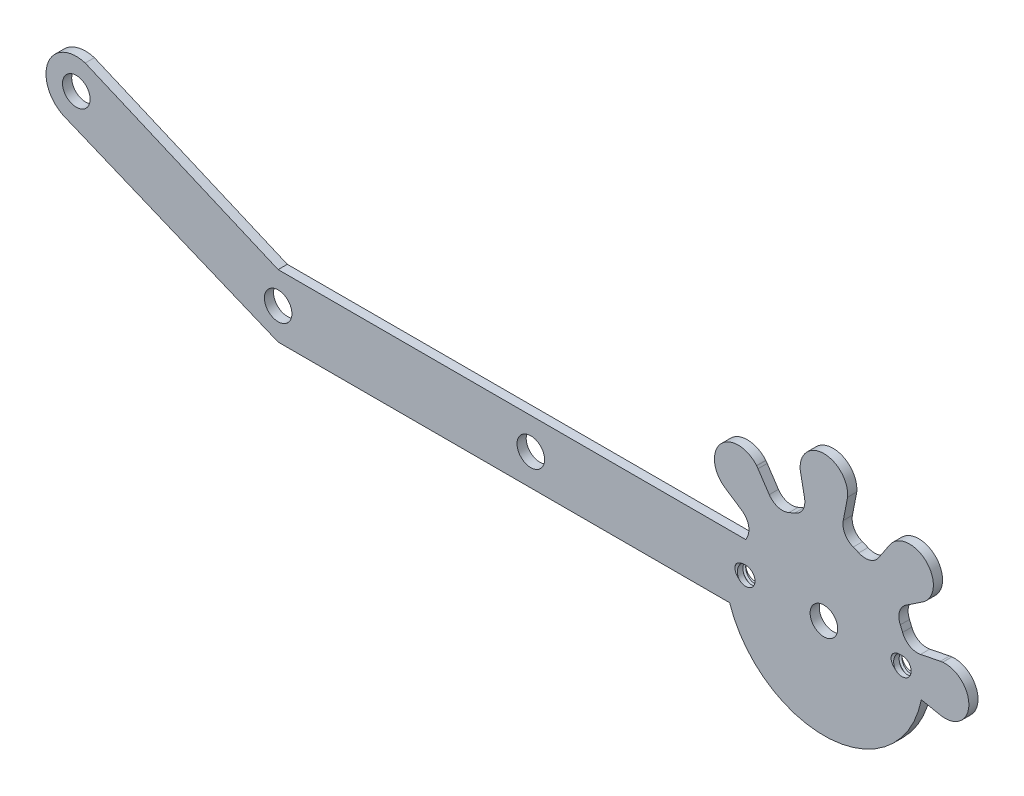
from build123d import *

# Parameters (mm, degrees)
MODEL_R                 = 1.5
MODEL_R_2               = 1
SALIENTE_EXTRUIR1_DEPTH = 1
ROSCA1_PITCH            = 0.9
ROSCA2_PITCH            = 0.9


with BuildPart() as part:
    # Model → Saliente-Extruir1 (new body)
    with BuildSketch(Plane.XY):
        with BuildLine():
            Line((64.920529254, 22.665964647), (65.392141921, 25.094713774))
            ThreePointArc((65.392141921, 25.094713774), (62.813729413, 27.921774704), (60.235316905, 25.094713774))
            Line((60.235316905, 25.094713774), (60.706929569, 22.665964648))
            ThreePointArc((60.706929569, 22.665964648), (60.522536002, 21.487316644), (59.617797329, 20.709717749))
            Line((59.617797329, 20.709717749), (59.017410103, 20.461029219))
            ThreePointArc((59.017410103, 20.461029219), (57.827817801, 20.37112782), (56.864001863, 21.074171875))
            Line((56.864001863, 21.074171875), (55.643604115, 22.905712275))
            ThreePointArc((55.643604115, 22.905712275), (55.574607075, 23.004223882), (55.501109991, 23.099425284))
            Line((55.501109991, 23.099425284), (55.4800974, 23.125037364))
            ThreePointArc((55.4800974, 23.125037364), (51.657850476, 23.30085835), (51.833671462, 19.478611426))
            Line((51.833671462, 19.478611426), (51.859283542, 19.457598835))
            ThreePointArc((51.859283542, 19.457598835), (51.954484944, 19.384101751), (52.052996551, 19.315104711))
            Line((52.052996551, 19.315104711), (53.884536951, 18.094706963))
            ThreePointArc((53.884536951, 18.094706963), (54.587581006, 17.130891025), (54.497679607, 15.941298723))
            ThreePointArc((54.497679607, 15.941298723), (54.413761816, 15.751815845), (54.334160767, 15.560479415))
            Line((54.334160767, 15.560479415), (30.913729409, 15.560479415))
            Line((30.913729409, 15.560479415), (3.413729409, 15.560479415))
            Line((3.413729409, 15.560479415), (-17.587002389, 24.534844015))
            ThreePointArc((-17.587002389, 24.534844015), (-21.676047123, 22.446375255), (-19.719697987, 18.292499154))
            Line((-19.719697987, 18.292499154), (3.413729409, 8.729479415))
            Line((3.413729409, 8.729479415), (30.913729409, 8.729479415))
            Line((30.913729409, 8.729479415), (52.551429091, 8.729479415))
            ThreePointArc((52.551429091, 8.729479415), (63.482015125, 1.349895241), (73.418940011, 10.021313662))
            Line((73.418940011, 10.021313662), (75.492760807, 9.606036458))
            ThreePointArc((75.492760807, 9.606036458), (75.611207308, 9.585166507), (75.730495152, 9.569819236))
            Line((75.730495152, 9.569819236), (75.763463773, 9.566566906))
            ThreePointArc((75.763463773, 9.566566906), (78.590524703, 12.144979414), (75.763463773, 14.723391922))
            Line((75.763463773, 14.723391922), (75.730495152, 14.720139592))
            ThreePointArc((75.730495152, 14.720139592), (75.61120731, 14.704792322), (75.49276081, 14.683922371))
            Line((75.49276081, 14.683922371), (73.334714643, 14.251779259))
            ThreePointArc((73.334714643, 14.251779259), (72.156066639, 14.436172826), (71.378467745, 15.340911498))
            ThreePointArc((71.378467745, 15.340911498), (71.259460181, 15.643315645), (71.129779214, 15.941298723))
            ThreePointArc((71.129779214, 15.941298723), (71.039877814, 17.130891025), (71.74292187, 18.094706964))
            Line((71.74292187, 18.094706964), (73.57446227, 19.315104712))
            ThreePointArc((73.57446227, 19.315104712), (73.672973877, 19.384101752), (73.768175279, 19.457598836))
            Line((73.768175279, 19.457598836), (73.793787359, 19.478611427))
            ThreePointArc((73.793787359, 19.478611427), (73.969608345, 23.300858351), (70.147361421, 23.125037365))
            Line((70.147361421, 23.125037365), (70.12634883, 23.099425285))
            ThreePointArc((70.12634883, 23.099425285), (70.052851746, 23.004223883), (69.983854706, 22.905712276))
            Line((69.983854706, 22.905712276), (68.763456957, 21.074171875))
            ThreePointArc((68.763456957, 21.074171875), (67.799641018, 20.371127819), (66.610048715, 20.461029218))
            ThreePointArc((66.610048715, 20.461029218), (66.312065639, 20.590710184), (66.009661494, 20.709717748))
            ThreePointArc((66.009661494, 20.709717748), (65.104922821, 21.487316642), (64.920529254, 22.665964647))
        make_face()
        with Locations((62.813729411, 12.144979414)):
            Circle(MODEL_R, mode=Mode.SUBTRACT)
        with Locations((30.913729409, 12.144979414)):
            Circle(MODEL_R, mode=Mode.SUBTRACT)
        with Locations((3.413729409, 12.144979414)):
            Circle(MODEL_R, mode=Mode.SUBTRACT)
        with Locations((-18.553270591, 21.379479415)):
            Circle(MODEL_R, mode=Mode.SUBTRACT)
        with Locations((54.313749997, 12.144979414)):
            Circle(MODEL_R_2, mode=Mode.SUBTRACT)
        with Locations((71.313708825, 12.144979414)):
            Circle(MODEL_R_2, mode=Mode.SUBTRACT)
    extrude(amount=SALIENTE_EXTRUIR1_DEPTH)

    # Rosca1: the profile of Perfil de rosca1 profile screwed along a right-hand helix of 11.111111 turns, 8 arcs to a turn; built about Z, then put on its axis
    rosca1_z = Axis((0, 0, 0), (0, 0, 1))
    rosca1_corners = [(0.9997, 0, -0.000173205), (1.21650635, 0, 0.124999999), (1.21650635, 0, 0.174999999), (0.9997, 0, 0.300173204)]
    with BuildLine(mode=Mode.PRIVATE) as rosca1_profile:
        Line(rosca1_corners[0], rosca1_corners[1])
        Line(rosca1_corners[1], rosca1_corners[2])
        Line(rosca1_corners[2], rosca1_corners[3])
        Line(rosca1_corners[3], rosca1_corners[0])
    rosca1_cap = Face(rosca1_profile.wire())
    rosca1_turn_angles = [0, 22.5, 45, 67.5, 90, 112.5, 135, 157.5, 180, 202.5, 225, 247.5, 270, 292.5, 315, 337.5, 360]
    rosca1_turn_weights = [1, 0.9238795325112867, 1, 0.9238795325112867, 1, 0.9238795325112867, 1, 0.9238795325112867, 1, 0.9238795325112867, 1, 0.9238795325112867, 1, 0.9238795325112867, 1, 0.9238795325112867, 1]
    rosca1_turn_rails = [Edge.make_bspline([Vector(p[0], p[1], 0).rotate(rosca1_z, rosca1_turn_angles[k]) / rosca1_turn_weights[k] + Vector(0, 0, p[2] + ROSCA1_PITCH * rosca1_turn_angles[k] / 360) for k in range(17)], [0, 0, 0, 1, 1, 2, 2, 3, 3, 4, 4, 5, 5, 6, 6, 7, 7, 8, 8, 8], 2, rosca1_turn_weights) for p in rosca1_corners]
    rosca1_turn_sides = [Face.make_surface_from_curves(rosca1_turn_rails[p[0]], rosca1_turn_rails[p[1]]) for p in [(0, 1), (1, 2), (2, 3), (3, 0)]]
    rosca1_last_angles = [3960, 3980, 4000]
    rosca1_last_weights = [1, 0.9396926207859084, 1]
    rosca1_last_rails = [Edge.make_bspline([Vector(p[0], p[1], 0).rotate(rosca1_z, rosca1_last_angles[k]) / rosca1_last_weights[k] + Vector(0, 0, p[2] + ROSCA1_PITCH * rosca1_last_angles[k] / 360) for k in range(3)], [0, 0, 0, 1, 1, 1], 2, rosca1_last_weights) for p in rosca1_corners]
    rosca1_last_sides = [Face.make_surface_from_curves(rosca1_last_rails[p[0]], rosca1_last_rails[p[1]]) for p in [(0, 1), (1, 2), (2, 3), (3, 0)]]
    rosca1 = Plane(origin=(71.313708825, 12.144979414, 3), x_dir=(-1, 0, 0), z_dir=(0, 0, -1)) * Solid(Shell([*[p.moved(Location((0, 0, ROSCA1_PITCH * i))) for i in range(11) for p in rosca1_turn_sides], *rosca1_last_sides, rosca1_cap, rosca1_cap.rotate(rosca1_z, 4000).moved(Location((0, 0, ROSCA1_PITCH * 4000 / 360)))]))
    add(rosca1, mode=Mode.SUBTRACT)

    # Rosca2: the profile of Perfil de rosca2 profile screwed along a right-hand helix of 11.111111 turns, 8 arcs to a turn; built about Z, then put on its axis
    rosca2_z = Axis((0, 0, 0), (0, 0, 1))
    rosca2_corners = [(0.9997, 0, -0.000173205), (1.21650635, 0, 0.124999999), (1.21650635, 0, 0.174999999), (0.9997, 0, 0.300173204)]
    with BuildLine(mode=Mode.PRIVATE) as rosca2_profile:
        Line(rosca2_corners[0], rosca2_corners[1])
        Line(rosca2_corners[1], rosca2_corners[2])
        Line(rosca2_corners[2], rosca2_corners[3])
        Line(rosca2_corners[3], rosca2_corners[0])
    rosca2_cap = Face(rosca2_profile.wire())
    rosca2_turn_angles = [0, 22.5, 45, 67.5, 90, 112.5, 135, 157.5, 180, 202.5, 225, 247.5, 270, 292.5, 315, 337.5, 360]
    rosca2_turn_weights = [1, 0.9238795325112867, 1, 0.9238795325112867, 1, 0.9238795325112867, 1, 0.9238795325112867, 1, 0.9238795325112867, 1, 0.9238795325112867, 1, 0.9238795325112867, 1, 0.9238795325112867, 1]
    rosca2_turn_rails = [Edge.make_bspline([Vector(p[0], p[1], 0).rotate(rosca2_z, rosca2_turn_angles[k]) / rosca2_turn_weights[k] + Vector(0, 0, p[2] + ROSCA2_PITCH * rosca2_turn_angles[k] / 360) for k in range(17)], [0, 0, 0, 1, 1, 2, 2, 3, 3, 4, 4, 5, 5, 6, 6, 7, 7, 8, 8, 8], 2, rosca2_turn_weights) for p in rosca2_corners]
    rosca2_turn_sides = [Face.make_surface_from_curves(rosca2_turn_rails[p[0]], rosca2_turn_rails[p[1]]) for p in [(0, 1), (1, 2), (2, 3), (3, 0)]]
    rosca2_last_angles = [3960, 3980, 4000]
    rosca2_last_weights = [1, 0.9396926207859084, 1]
    rosca2_last_rails = [Edge.make_bspline([Vector(p[0], p[1], 0).rotate(rosca2_z, rosca2_last_angles[k]) / rosca2_last_weights[k] + Vector(0, 0, p[2] + ROSCA2_PITCH * rosca2_last_angles[k] / 360) for k in range(3)], [0, 0, 0, 1, 1, 1], 2, rosca2_last_weights) for p in rosca2_corners]
    rosca2_last_sides = [Face.make_surface_from_curves(rosca2_last_rails[p[0]], rosca2_last_rails[p[1]]) for p in [(0, 1), (1, 2), (2, 3), (3, 0)]]
    rosca2 = Plane(origin=(54.313749997, 12.144979414, 3), x_dir=(-1, 0, 0), z_dir=(0, 0, -1)) * Solid(Shell([*[p.moved(Location((0, 0, ROSCA2_PITCH * i))) for i in range(11) for p in rosca2_turn_sides], *rosca2_last_sides, rosca2_cap, rosca2_cap.rotate(rosca2_z, 4000).moved(Location((0, 0, ROSCA2_PITCH * 4000 / 360)))]))
    add(rosca2, mode=Mode.SUBTRACT)


solid = part.part
